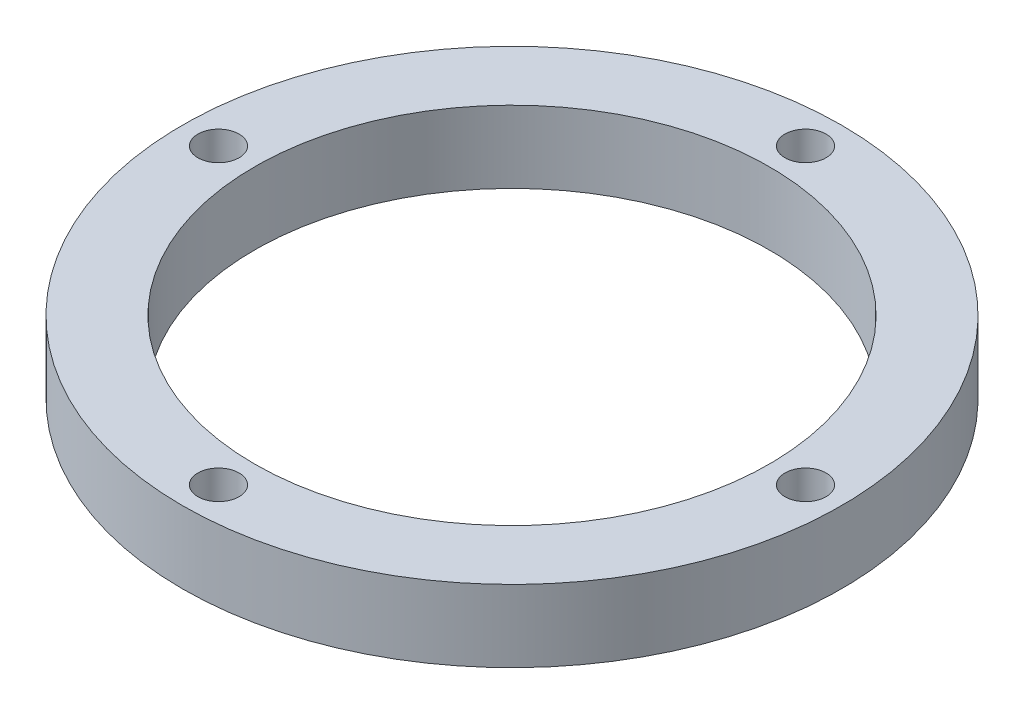
from build123d import *

# Parameters (mm, degrees)
SKETCH1_R           = 32
SKETCH1_R_2         = 25
BOSS_EXTRUDE1_DEPTH = 7
SKETCH5_R           = 2
CUT_EXTRUDE1_DEPTH  = 46.793012567
CIRPATTERN1_COUNT   = 4


with BuildPart() as part:
    # Sketch1 → Boss-Extrude1 (new body)
    with BuildSketch(Plane(origin=(0, 0, 0), x_dir=(1, 0, 0), z_dir=(0, 1, 0))):
        Circle(SKETCH1_R)
        Circle(SKETCH1_R_2, mode=Mode.SUBTRACT)
    extrude(amount=BOSS_EXTRUDE1_DEPTH)

    # Sketch5 → Cut-Extrude1 (cut, through all)
    with BuildSketch(Plane(origin=(0, 7, 0), x_dir=(1, 0, 0), z_dir=(0, 1, 0))):
        with Locations((28.5, 0)):
            Circle(SKETCH5_R)
    cut_extrude1 = extrude(amount=-CUT_EXTRUDE1_DEPTH, mode=Mode.SUBTRACT)

    # CirPattern1: Cut-Extrude1 ×4 about axis
    cirpattern1_axis = Axis((0, 0, 0), (0, 1, 0))
    for i in range(1, CIRPATTERN1_COUNT):
        add(cut_extrude1.rotate(cirpattern1_axis, i * 360 / CIRPATTERN1_COUNT), mode=Mode.SUBTRACT)


solid = part.part
